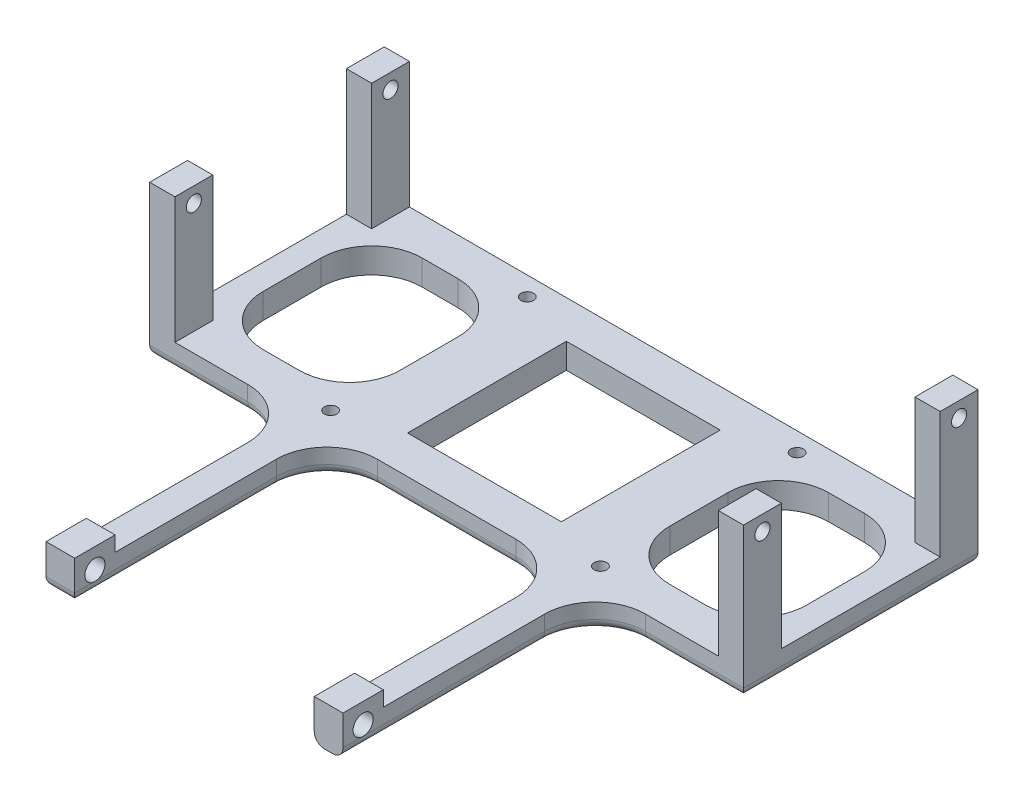
from build123d import *

# Parameters (mm, degrees)
BOSS_EXTRUDE1_DEPTH     = 5
FILLET1_R               = 10
FILLET2_R               = 10
FILLET3_R               = 10
FILLET4_R               = 10
SKETCH2_W               = 5
SKETCH2_H               = 7.5
BOSS_EXTRUDE2_DEPTH     = 25
MIRROR2_COPY_1_SKETCH_W = 5
MIRROR2_COPY_1_SKETCH_H = 7.5
MIRROR2_COPY_1_DEPTH    = 25
SKETCH3_R               = 1.5
CUT_EXTRUDE1_DEPTH      = 119.966907163
SKETCH4_W               = 2.694155106
SKETCH4_H               = 50
SKETCH4_W_2             = 3
BOSS_EXTRUDE3_DEPTH     = 8
SKETCH5_W               = 5.694155106
SKETCH5_H               = 3
CUT_EXTRUDE2_DEPTH      = 42
CUT_EXTRUDE3_DEPTH      = 115.422257996
FILLET5_R               = 10
FILLET6_R               = 10
FILLET7_R               = 10
FILLET8_R               = 10
BOSS_EXTRUDE4_REACH     = 112.848
SKETCH7_W               = 5
SKETCH7_H               = 5
FILLET9_R               = 10
FILLET10_DEPTH          = 5
FILLET11_R              = 10
FILLET12_DEPTH          = 5
FILLET13_R              = 2


with BuildPart() as part:
    # Sketch1 → Boss-Extrude1 (new body)
    with BuildSketch(Plane(origin=(0, 0, 0), x_dir=(1, 0, 0), z_dir=(0, 1, 0))):
        with BuildLine():
            Line((-34.25, 15.75), (-26.75, 15.75))
            Line((-26.75, 15.75), (-26.75, 18.25))
            ThreePointArc((-26.75, 18.25), (-27.633883476, 20.383883476), (-25.5, 19.5))
            Line((-25.5, 19.5), (25.5, 19.5))
            ThreePointArc((25.5, 19.5), (26.75, 20.75), (28, 19.5))
            ThreePointArc((28, 19.5), (27.633883476, 18.616116524), (26.75, 18.25))
            Line((26.75, 18.25), (26.75, 15.75))
            Line((26.75, 15.75), (34.25, 15.75))
            Line((34.25, 15.75), (58.875, 15.75))
            Line((58.875, 15.75), (58.875, 23.25))
            Line((58.875, 23.25), (-58.875, 23.25))
            Line((-58.875, 23.25), (-58.875, 15.75))
            Line((-58.875, 15.75), (-34.25, 15.75))
        make_face()
        with BuildLine():
            Line((-26.75, 18.25), (-26.75, 15.75))
            Line((-26.75, 15.75), (-15.25, 15.75))
            Line((-15.25, 15.75), (15.25, 15.75))
            Line((15.25, 15.75), (26.75, 15.75))
            Line((26.75, 15.75), (26.75, 18.25))
            ThreePointArc((26.75, 18.25), (25.866116524, 18.616116524), (25.5, 19.5))
            Line((25.5, 19.5), (-25.5, 19.5))
            ThreePointArc((-25.5, 19.5), (-25.866116524, 18.616116524), (-26.75, 18.25))
        make_face()
        with BuildLine():
            Line((0, -19.5), (-25.5, -19.5))
            ThreePointArc((-25.5, -19.5), (-26.75, -20.75), (-28, -19.5))
            Line((-28, -19.5), (-58.875, -19.5))
            Line((-58.875, -19.5), (-58.875, -23.25))
            Line((-58.875, -23.25), (58.875, -23.25))
            Line((58.875, -23.25), (58.875, -15.75))
            Line((58.875, -15.75), (34.25, -15.75))
            Line((34.25, -15.75), (26.75, -15.75))
            Line((26.75, -15.75), (26.75, -18.25))
            ThreePointArc((26.75, -18.25), (27.633883476, -18.616116524), (28, -19.5))
            ThreePointArc((28, -19.5), (26.75, -20.75), (25.5, -19.5))
            Line((25.5, -19.5), (0, -19.5))
        make_face()
        with BuildLine():
            Line((-26.75, -15.75), (-26.75, -18.25))
            ThreePointArc((-26.75, -18.25), (-25.866116524, -18.616116524), (-25.5, -19.5))
            Line((-25.5, -19.5), (0, -19.5))
            Line((0, -19.5), (25.5, -19.5))
            ThreePointArc((25.5, -19.5), (25.866116524, -18.616116524), (26.75, -18.25))
            Line((26.75, -18.25), (26.75, -15.75))
            Line((26.75, -15.75), (15.25, -15.75))
            Line((15.25, -15.75), (-15.25, -15.75))
            Line((-15.25, -15.75), (-26.75, -15.75))
        make_face()
        with BuildLine():
            ThreePointArc((-28, -19.5), (-27.633883476, -18.616116524), (-26.75, -18.25))
            Line((-26.75, -18.25), (-26.75, -15.75))
            Line((-26.75, -15.75), (-34.25, -15.75))
            Line((-34.25, -15.75), (-58.875, -15.75))
            Line((-58.875, -15.75), (-58.875, -19.5))
            Line((-58.875, -19.5), (-28, -19.5))
        make_face()
        Polygon((-26.75, 0), (-26.75, -15.75), (-15.25, -15.75), (-15.25, 0), (-15.25, 15.75), (-26.75, 15.75), align=None)
        Polygon((15.25, 0), (15.25, -15.75), (26.75, -15.75), (26.75, 15.75), (15.25, 15.75), align=None)
    extrude(amount=BOSS_EXTRUDE1_DEPTH)

    # Fillet1
    fillet1_edges = [part.edges().sort_by_distance(p)[0] for p in [
        (-26.75, 2.5, -15.75),
    ]]
    fillet(fillet1_edges, radius=FILLET1_R)

    # Fillet2
    fillet2_edges = [part.edges().sort_by_distance(p)[0] for p in [
        (-26.75, 2.5, 15.75),
    ]]
    fillet(fillet2_edges, radius=FILLET2_R)

    # Fillet3
    fillet3_edges = [part.edges().sort_by_distance(p)[0] for p in [
        (26.75, 2.5, -15.75),
    ]]
    fillet(fillet3_edges, radius=FILLET3_R)

    # Fillet4
    fillet4_edges = [part.edges().sort_by_distance(p)[0] for p in [
        (26.75, 2.5, 15.75),
    ]]
    fillet(fillet4_edges, radius=FILLET4_R)

    # Sketch2 → Boss-Extrude2 (add)
    with BuildSketch(Plane(origin=(0, 5, 0), x_dir=(1, 0, 0), z_dir=(0, 1, 0))):
        with Locations((56.375, 19.5)):
            Rectangle(SKETCH2_W, SKETCH2_H)
    boss_extrude2 = extrude(amount=BOSS_EXTRUDE2_DEPTH)

    # Mirror1: Boss-Extrude2 across plane
    add(boss_extrude2.mirror(Plane(origin=(0, 0, 0), x_dir=(0, 0, 1), z_dir=(1, 0, 0))))

    # Mirror2: Boss-Extrude2 across plane
    add(boss_extrude2.mirror(Plane.XY))

    # Mirror2 copy 1 sketch → Mirror2 copy 1 (add)
    with BuildSketch(Plane(origin=(0, 5, 0), x_dir=(-1, 0, 0), z_dir=(0, 1, 0))):
        with Locations((56.375, 19.5)):
            Rectangle(MIRROR2_COPY_1_SKETCH_W, MIRROR2_COPY_1_SKETCH_H)
    extrude(amount=MIRROR2_COPY_1_DEPTH)

    # Sketch3 → Cut-Extrude1 (cut, symmetric)
    with BuildSketch(Plane.ZY.offset(-53.875)):
        with Locations((-19.5, 27)):
            Circle(SKETCH3_R)
    cut_extrude1 = extrude(amount=CUT_EXTRUDE1_DEPTH, both=True, mode=Mode.SUBTRACT)

    # Mirror3: Cut-Extrude1 across plane
    add(cut_extrude1.mirror(Plane.XY), mode=Mode.SUBTRACT)

    # Sketch4 → Boss-Extrude3 (add)
    with BuildSketch(Plane(origin=(0, 0, 0), x_dir=(-1, 0, 0), z_dir=(0, -1, 0))):
        with Locations((-28.097077553, -48.25)):
            Rectangle(SKETCH4_W, SKETCH4_H)
        with Locations((-25.25, -48.25)):
            Rectangle(SKETCH4_W_2, SKETCH4_H)
    boss_extrude3 = extrude(amount=-BOSS_EXTRUDE3_DEPTH)

    # Sketch5 → Cut-Extrude2 (cut)
    with BuildSketch(Plane(origin=(0, 0, 23.25), x_dir=(-1, 0, 0), z_dir=(0, 0, -1))):
        with Locations((-26.597077553, 6.5)):
            Rectangle(SKETCH5_W, SKETCH5_H)
    cut_extrude2 = extrude(amount=-CUT_EXTRUDE2_DEPTH, mode=Mode.SUBTRACT)

    # Sketch6 → Cut-Extrude3 (cut, through all)
    with BuildSketch(Plane.ZY.offset(-23.75)):
        with BuildLine():
            ThreePointArc((71.25, 4), (70.664213562, 5.414213562), (69.25, 6))
            Line((69.25, 6), (69.25, 2))
            ThreePointArc((69.25, 2), (70.664213562, 2.585786438), (71.25, 4))
        make_face()
        with BuildLine():
            Line((69.25, 2), (69.25, 6))
            ThreePointArc((69.25, 6), (67.25, 4), (69.25, 2))
        make_face()
    cut_extrude3 = extrude(amount=-CUT_EXTRUDE3_DEPTH, mode=Mode.SUBTRACT)

    # Fillet5
    fillet5_edges = [part.edges().sort_by_distance(p)[0] for p in [
        (23.75, 2.5, 23.25),
    ]]
    fillet(fillet5_edges, radius=FILLET5_R)

    # Fillet6
    fillet6_edges = [part.edges().sort_by_distance(p)[0] for p in [
        (29.444155106, 2.5, 23.25),
    ]]
    fillet(fillet6_edges, radius=FILLET6_R)

    # Mirror4: Boss-Extrude3, Cut-Extrude2, Cut-Extrude3 across plane
    add(boss_extrude3.mirror(Plane(origin=(0, 0, 0), x_dir=(0, 0, 1), z_dir=(1, 0, 0))))
    add(cut_extrude2.mirror(Plane(origin=(0, 0, 0), x_dir=(0, 0, 1), z_dir=(1, 0, 0))), mode=Mode.SUBTRACT)
    add(cut_extrude3.mirror(Plane(origin=(0, 0, 0), x_dir=(0, 0, 1), z_dir=(1, 0, 0))), mode=Mode.SUBTRACT)

    # Fillet7
    fillet7_edges = [part.edges().sort_by_distance(p)[0] for p in [
        (-23.75, 2.5, 23.25),
    ]]
    fillet(fillet7_edges, radius=FILLET7_R)

    # Fillet8
    fillet8_edges = [part.edges().sort_by_distance(p)[0] for p in [
        (-29.444155106, 2.5, 23.25),
    ]]
    fillet(fillet8_edges, radius=FILLET8_R)

    # Sketch7 → Boss-Extrude4 (add, up to next)
    with BuildSketch(Plane.XY.offset(-15.75), mode=Mode.PRIVATE) as boss_extrude4_sk1:
        with Locations((-56.375, 2.5)):
            Rectangle(SKETCH7_W, SKETCH7_H)
    boss_extrude4_tool1 = extrude(boss_extrude4_sk1.sketch, amount=BOSS_EXTRUDE4_REACH, mode=Mode.PRIVATE) - part.part
    boss_extrude4 = boss_extrude4_tool1.solids().sort_by_distance((-56.375, 2.5, -15.75))[0]
    add(boss_extrude4)

    # Mirror5: Boss-Extrude4 across plane
    add(boss_extrude4.mirror(Plane(origin=(0, 0, 0), x_dir=(0, 0, 1), z_dir=(1, 0, 0))))

    # Fillet9
    # the kernel refuses this fillet: 10 mm, written as the material it adds along each edge
    with BuildSketch(Plane(origin=(53.875, 0, -15.75), x_dir=(0, 0, 1), z_dir=(0, 1, 0))) as fillet9_piece_1:
        with BuildLine():
            CenterArc((FILLET9_R, -FILLET9_R), FILLET9_R, 90, 90)
            Line((0, -FILLET9_R), (0, 0))
            Line((0, 0), (FILLET9_R, 0))
        make_face()
    extrude(amount=5)

    # Fillet10: read off the stored shape, not the designer's step
    # Fillet10 outline → Fillet10 (add)
    with BuildSketch(Plane(origin=(0, 0, 0), x_dir=(1, 0, 0), z_dir=(0, 1, 0))):
        with BuildLine():
            ThreePointArc((53.875, -5.75), (50.946067812, -12.821067812), (43.875, -15.75))
            Line((43.875, -15.75), (53.875, -15.75))
            Line((53.875, -15.75), (53.875, -5.75))
        make_face()
    extrude(amount=FILLET10_DEPTH)

    # Fillet11
    # the kernel refuses this fillet: 10 mm, written as the material it adds along each edge
    with BuildSketch(Plane(origin=(-53.875, 0, -15.75), x_dir=(1, 0, 0), z_dir=(0, 1, 0))) as fillet11_piece_1:
        with BuildLine():
            CenterArc((FILLET11_R, -FILLET11_R), FILLET11_R, 90, 90)
            Line((0, -FILLET11_R), (0, 0))
            Line((0, 0), (FILLET11_R, 0))
        make_face()
    extrude(amount=5)

    # Fillet12: read off the stored shape, not the designer's step
    # Fillet12 outline → Fillet12 (add)
    with BuildSketch(Plane(origin=(0, 0, 0), x_dir=(1, 0, 0), z_dir=(0, 1, 0))):
        with BuildLine():
            Line((-53.875, -15.75), (-43.875, -15.75))
            ThreePointArc((-43.875, -15.75), (-50.946067812, -12.821067812), (-53.875, -5.75))
            Line((-53.875, -5.75), (-53.875, -15.75))
        make_face()
    extrude(amount=FILLET12_DEPTH)

    # Fillet13
    fillet13_edges = [part.edges().sort_by_distance(p)[0] for p in [
        (0, 0, 23.25),
        (23.75, 0, 53.25),
        (20.821067812, 0, 26.178932188),
        (29.444155106, 0, 53.25),
        (32.373087294, 0, 26.178932188),
        (-26.597077553, 0, 73.25),
        (-58.875, 0, 0),
        (0, 0, -23.25),
        (58.875, 0, 0),
        (-23.75, 0, 53.25),
        (-20.821067812, 0, 26.178932188),
        (-49.159577553, 0, 23.25),
        (-29.444155106, 0, 53.25),
        (-32.373087294, 0, 26.178932188),
        (49.159577553, 0, 23.25),
    ]]
    fillet(fillet13_edges, radius=FILLET13_R - 0.0001)  # a hair under: the kernel refuses the full size


solid = part.part
